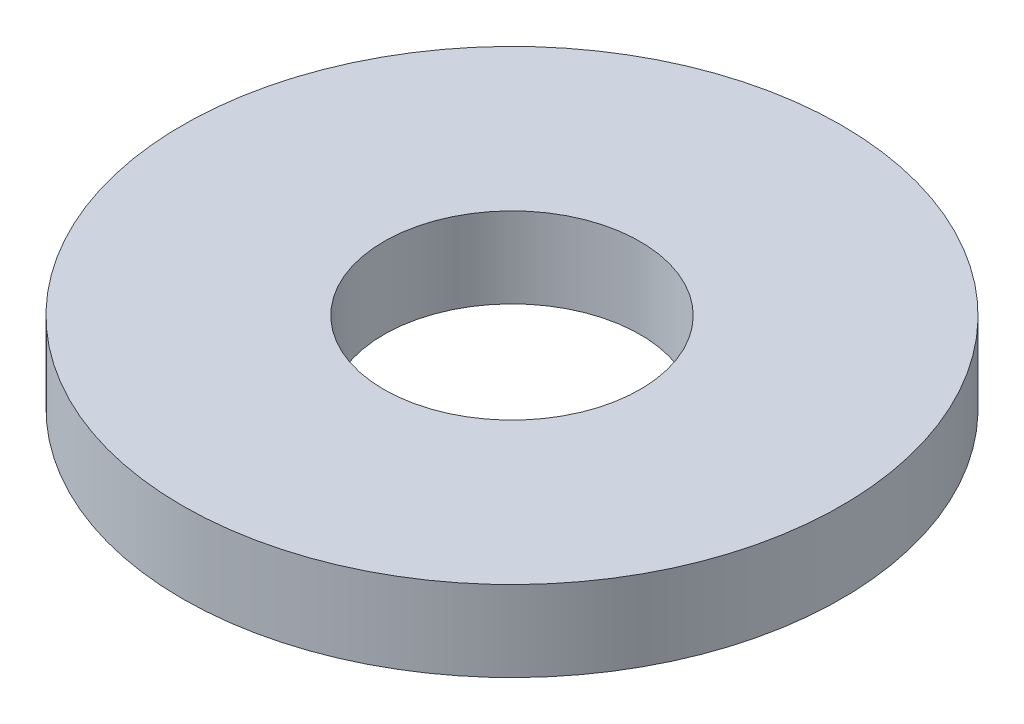
from build123d import *

# Parameters (mm, degrees)
SKETCH1_R           = 45
BOSS_EXTRUDE1_DEPTH = 11
SKETCH2_R           = 17.5
CUT_EXTRUDE1_DEPTH  = 65.58327957


with BuildPart() as part:
    # Sketch1 → Boss-Extrude1 (new body)
    with BuildSketch(Plane(origin=(0, 0, 0), x_dir=(1, 0, 0), z_dir=(0, 1, 0))):
        Circle(SKETCH1_R)
    extrude(amount=BOSS_EXTRUDE1_DEPTH)

    # Sketch2 → Cut-Extrude1 (cut, through all)
    with BuildSketch(Plane(origin=(0, 0, 0), x_dir=(1, 0, 0), z_dir=(0, 1, 0))):
        Circle(SKETCH2_R)
    extrude(amount=CUT_EXTRUDE1_DEPTH, mode=Mode.SUBTRACT)


solid = part.part
